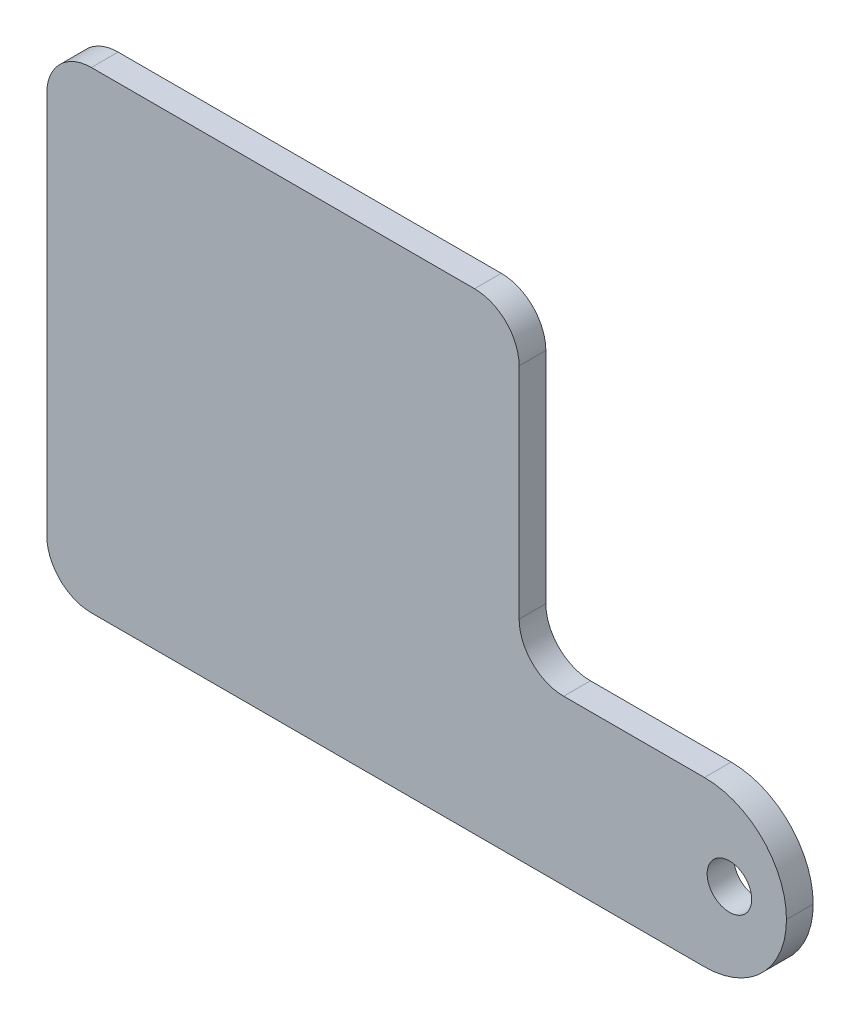
from build123d import *

# Parameters (mm, degrees)
SKETCH1_R           = 2.5
BOSS_EXTRUDE1_DEPTH = 3
FILLET1_R           = 5
FILLET2_R           = 5
FILLET4_R           = 9.2


with BuildPart() as part:
    # Sketch1 → Boss-Extrude1 (new body)
    with BuildSketch(Plane.XY):
        Polygon((53, 53), (53, 18.4), (83, 18.4), (83, 0), (0, 0), (0, 53), align=None)
        with Locations((76.6, 9.2)):
            Circle(SKETCH1_R, mode=Mode.SUBTRACT)
    extrude(amount=BOSS_EXTRUDE1_DEPTH)

    # Fillet1
    fillet1_edges = [part.edges().sort_by_distance(p)[0] for p in [
        (0, 53, 1.5),
        (53, 53, 1.5),
        (0, 0, 1.5),
    ]]
    fillet(fillet1_edges, radius=FILLET1_R)

    # Fillet2
    fillet2_edges = [part.edges().sort_by_distance(p)[0] for p in [
        (53, 18.4, 1.5),
    ]]
    fillet(fillet2_edges, radius=FILLET2_R)

    # Fillet4
    fillet4_edges = [part.edges().sort_by_distance(p)[0] for p in [
        (83, 0, 1.5),
        (83, 18.4, 1.5),
    ]]
    fillet(fillet4_edges, radius=FILLET4_R - 0.0001)  # a hair under: the kernel refuses the full size


solid = part.part
